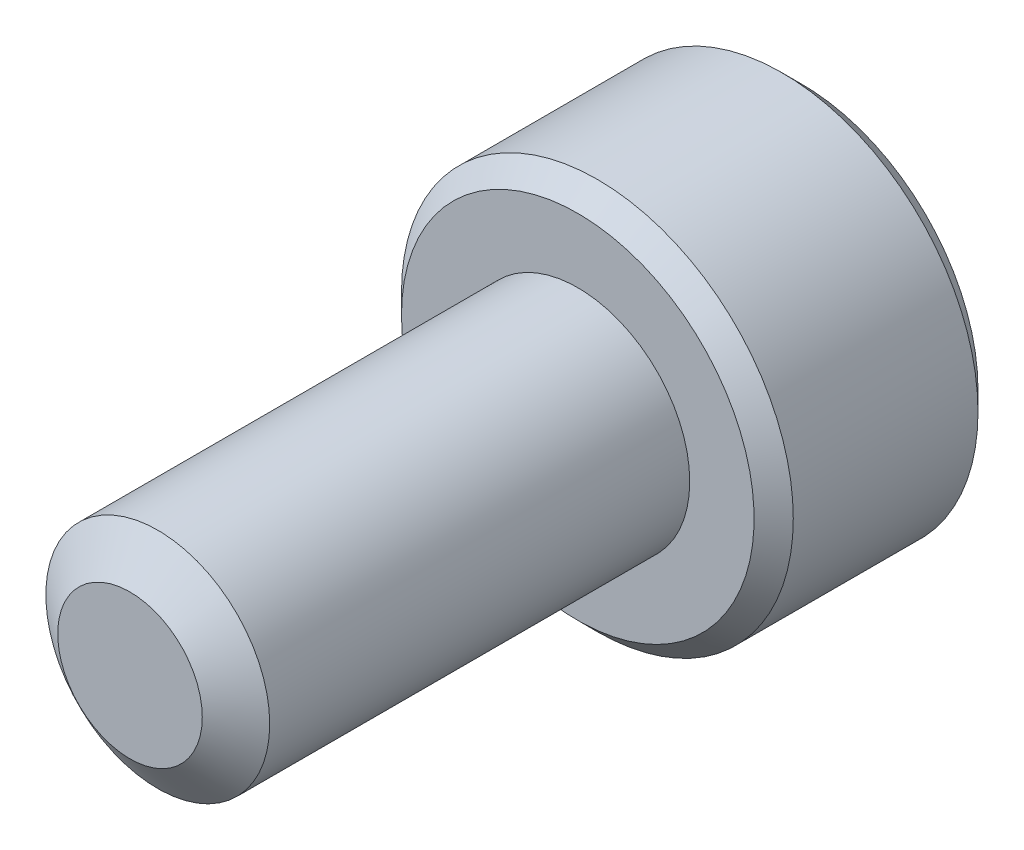
from build123d import *

# Parameters (mm, degrees)
SKETCH1_R          = 2
EXTRUDE1_DEPTH     = 8
SKETCH6_R          = 3.5
EXTRUDE2_DEPTH     = 4
CUT_EXTRUDE1_DEPTH = 2.25
CHAMFER1_SIZE      = 0.35


with BuildPart() as part:
    # Sketch1 → Extrude1 (new body)
    with BuildSketch(Plane.XY):
        Circle(SKETCH1_R)
    extrude(amount=-EXTRUDE1_DEPTH)

    # Sketch4 → Cut-Revolve1 (revolve, cut)
    with BuildSketch(Plane(origin=(0, 0, 0), x_dir=(0, 0, -1), z_dir=(1, 0, 0))):
        Polygon((0.496211411, 2), (0, 1.291336663), (0, 2), align=None)
    revolve(axis=Axis((0, 0, 0), (0, 0, -1)), mode=Mode.SUBTRACT)

    # Sketch6 → Extrude2 (add)
    with BuildSketch(Plane(origin=(0, 0, -8), x_dir=(-1, 0, 0), z_dir=(0, 0, -1))):
        Circle(SKETCH6_R)
    extrude(amount=EXTRUDE2_DEPTH)

    # Sketch7 → Cut-Extrude1 (cut)
    with BuildSketch(Plane(origin=(0, 0, -12), x_dir=(-1, 0, 0), z_dir=(0, 0, -1))):
        Polygon((0, 1.732050808), (-1.5, 0.866025404), (-1.5, -0.866025404), (0, -1.732050808), (1.5, -0.866025404), (1.5, 0.866025404), align=None)
    extrude(amount=-CUT_EXTRUDE1_DEPTH, mode=Mode.SUBTRACT)

    # Cut-Extrude2 cone 1 section (through the dimple's axis) → Cut-Extrude2 (revolve, cut)
    with BuildSketch(Plane(origin=(0, 0, -12), x_dir=(0, 1, 0), z_dir=(1, 0, 0))):
        Polygon((0, 0), (1.732050808, 0), (0, 1.732050808), align=None)
    revolve(axis=Axis((0, 0, -12), (0, 0, 1)), mode=Mode.SUBTRACT)

    # Chamfer1
    chamfer1_edges = [part.edges().sort_by_distance(p)[0] for p in [
        (3.5, 0, -12),
        (3.5, 0, -8),
    ]]
    chamfer(chamfer1_edges, length=CHAMFER1_SIZE)


solid = part.part
